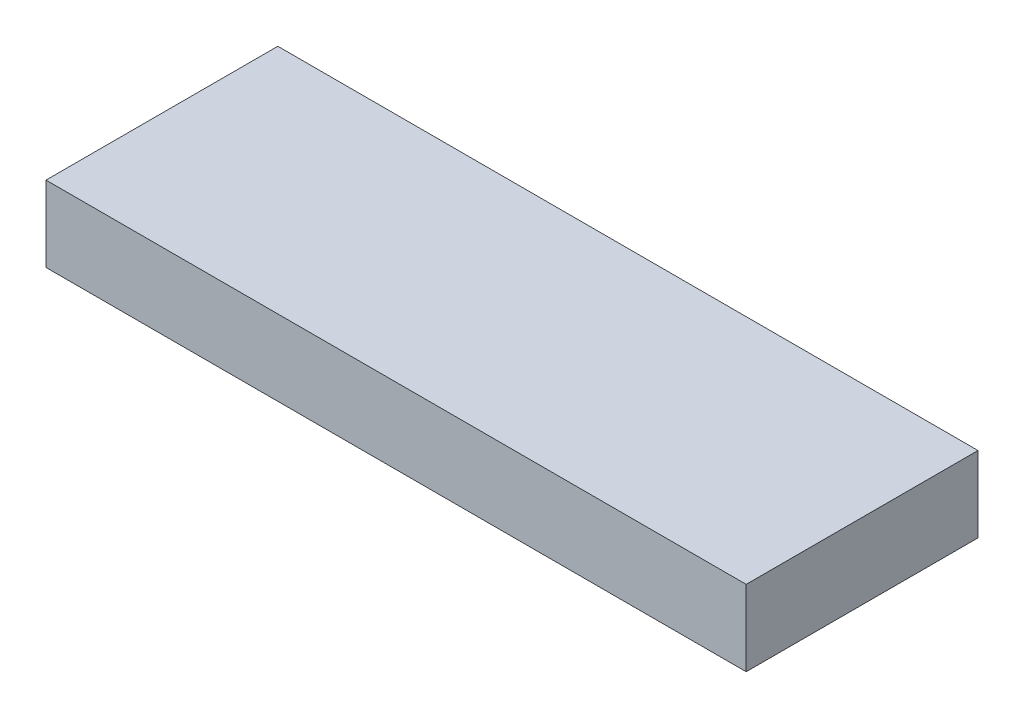
from build123d import *

# Parameters (mm, degrees)
SKETCH1_W           = 148
SKETCH1_H           = 49
BOSS_EXTRUDE1_DEPTH = 16


with BuildPart() as part:
    # Sketch1 → Boss-Extrude1 (new body)
    with BuildSketch(Plane(origin=(0, 0, 0), x_dir=(1, 0, 0), z_dir=(0, 1, 0))):
        Rectangle(SKETCH1_W, SKETCH1_H)
    extrude(amount=BOSS_EXTRUDE1_DEPTH)


solid = part.part
